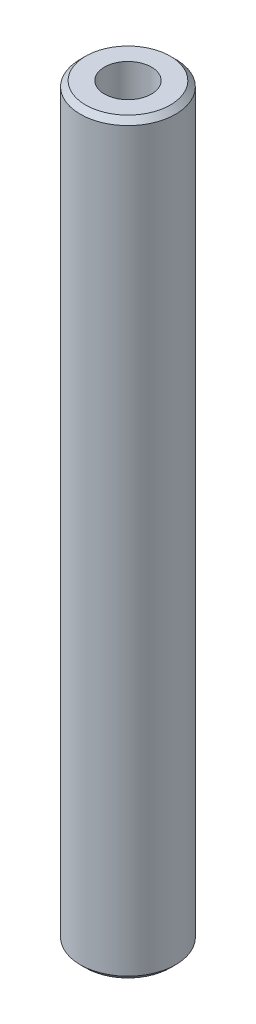
from build123d import *

# Parameters (mm, degrees)
SKETCH1_R           = 15
BOSS_EXTRUDE1_DEPTH = 235.154857146
SKETCH2_R           = 7.379236065
CUT_EXTRUDE1_DEPTH  = 237.109734741
CHAMFER1_SIZE       = 1.675272113


with BuildPart() as part:
    # Sketch1 → Boss-Extrude1 (new body)
    with BuildSketch(Plane(origin=(0, 0, 0), x_dir=(1, 0, 0), z_dir=(0, 1, 0))):
        Circle(SKETCH1_R)
    extrude(amount=BOSS_EXTRUDE1_DEPTH)

    # Sketch2 → Cut-Extrude1 (cut, through all)
    with BuildSketch(Plane(origin=(0, 0, 0), x_dir=(1, 0, 0), z_dir=(0, 1, 0))):
        Circle(SKETCH2_R)
    extrude(amount=CUT_EXTRUDE1_DEPTH, mode=Mode.SUBTRACT)

    # Chamfer1
    chamfer1_edges = [part.edges().sort_by_distance(p)[0] for p in [
        (-15, 235.154857146, 0),
        (-15, 0, 0),
    ]]
    chamfer(chamfer1_edges, length=CHAMFER1_SIZE)


solid = part.part
